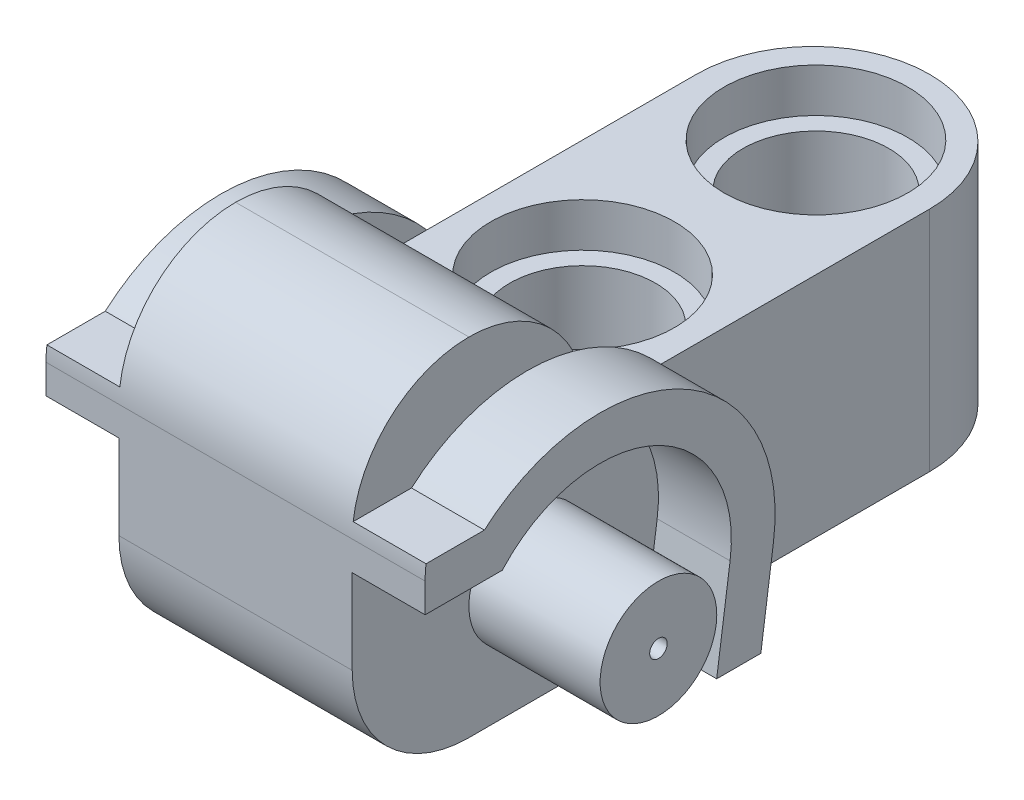
from build123d import *

# Parameters (mm, degrees)
SKETCH_2_W               = 23.8
SKETCH_2_H               = 16
EXTRUDE_1_DEPTH          = 4
EXTRUDE_START            = 4
EXTRUDE_3_DEPTH          = 4.5
SKETCH_5_R               = 0.3
CUT_EXTRUDE_10_DEPTH     = 1
CUT_EXTRUDE_5_DEPTH      = 22.285910833
EXTRUDE_2_DEPTH          = 2.5
CUT_EXTRUDE_6_DEPTH      = 24.036926878
CUT_EXTRUDE_6_DEPTH_BACK = 24.036926878
CUT_EXTRUDE_7_DEPTH      = 1.5
CUT_EXTRUDE_START        = -6.3
CUT_EXTRUDE_8_DEPTH      = 1.5
CUT_EXTRUDE_9_DEPTH      = 22.285910833
CUT_EXTRUDE_9_DEPTH_BACK = 22.285910833
SKETCH_4_W               = 11.51085618
SKETCH_4_H               = 4.1
FILLET_1_R               = 4


with BuildPart() as part:
    # 草图2 → 凸台-拉伸1 (new body)
    with BuildSketch(Plane(origin=(0, 0, 0), x_dir=(0, 0, -1), z_dir=(1, 0, 0))):
        with Locations((5.9, 0)):
            Rectangle(SKETCH_2_W, SKETCH_2_H)
    extrude(amount=EXTRUDE_1_DEPTH)

    # 草图2<10> → 凸台-拉伸3 (add)
    with BuildSketch(Plane(origin=(0, 0, 0), x_dir=(0, 0, -1), z_dir=(1, 0, 0)).offset(EXTRUDE_START)):
        with BuildLine():
            ThreePointArc((0, -2), (1.414213562, -1.414213562), (2, 0))
            Line((2, 0), (0, 0))
            Line((0, 0), (0, -2))
        make_face()
        with BuildLine():
            Line((0, 0), (2, 0))
            ThreePointArc((2, 0), (1.414213562, 1.414213562), (0, 2))
            Line((0, 2), (0, 0))
        make_face()
        with BuildLine():
            Line((0, -2), (0, 0))
            Line((0, 0), (-2, 0))
            ThreePointArc((-2, 0), (-1.414213562, -1.414213562), (0, -2))
        make_face()
        with BuildLine():
            Line((-2, 0), (0, 0))
            Line((0, 0), (0, 2))
            ThreePointArc((0, 2), (-1.414213562, 1.414213562), (-2, 0))
        make_face()
    extrude(amount=EXTRUDE_3_DEPTH)

    # 草图5 → 切除-拉伸10 (cut)
    with BuildSketch(Plane(origin=(8.5, 0, 0), x_dir=(0, 0, -1), z_dir=(1, 0, 0))):
        Circle(SKETCH_5_R)
    extrude(amount=-CUT_EXTRUDE_10_DEPTH, mode=Mode.SUBTRACT)

    # 草图2<9> → 切除-拉伸5 (cut, through all)
    with BuildSketch(Plane(origin=(0, 0, 0), x_dir=(0, 0, -1), z_dir=(1, 0, 0))):
        with BuildLine():
            ThreePointArc((2.244994432, 3.9), (2.123509625, 3.96745597), (2, 4.031128874))
            Line((2, 4.031128874), (2, 3.9))
            Line((2, 3.9), (2.244994432, 3.9))
        make_face()
        with BuildLine():
            ThreePointArc((4.559605246, 3.9), (3.39539975, 4.946843493), (2, 5.656854249))
            Line((2, 5.656854249), (2, 4.031128874))
            ThreePointArc((2, 4.031128874), (2.123509625, 3.96745597), (2.244994432, 3.9))
            Line((2.244994432, 3.9), (4.559605246, 3.9))
        make_face()
        with BuildLine():
            Line((17.8, 8), (2, 8))
            Line((2, 8), (2, 5.656854249))
            ThreePointArc((2, 5.656854249), (3.39539975, 4.946843493), (4.559605246, 3.9))
            Line((4.559605246, 3.9), (17.8, 3.9))
            Line((17.8, 3.9), (17.8, 8))
        make_face()
        with BuildLine():
            Line((2, -4.031128874), (2, -5.656854249))
            ThreePointArc((2, -5.656854249), (3.002792751, -5.194539026), (3.903880188, -4.556283516))
            Line((3.903880188, -4.556283516), (3.996114821, -3.9))
            Line((3.996114821, -3.9), (2.244994432, -3.9))
            ThreePointArc((2.244994432, -3.9), (2.123509625, -3.96745597), (2, -4.031128874))
        make_face()
        with BuildLine():
            ThreePointArc((3.903880188, -4.556283516), (3.002792751, -5.194539026), (2, -5.656854249))
            Line((2, -5.656854249), (2, -8))
            Line((2, -8), (3.419897399, -8))
            Line((3.419897399, -8), (3.903880188, -4.556283516))
        make_face()
        with BuildLine():
            ThreePointArc((3.903880188, -4.556283516), (4.244446187, -4.240834418), (4.559605246, -3.9))
            Line((4.559605246, -3.9), (3.996114821, -3.9))
            Line((3.996114821, -3.9), (3.903880188, -4.556283516))
        make_face()
        with BuildLine():
            Line((4.934638757, -8), (5.51085618, -3.9))
            Line((5.51085618, -3.9), (4.559605246, -3.9))
            ThreePointArc((4.559605246, -3.9), (4.244446187, -4.240834418), (3.903880188, -4.556283516))
            Line((3.903880188, -4.556283516), (3.419897399, -8))
            Line((3.419897399, -8), (4.934638757, -8))
        make_face()
        Polygon((17.8, -8), (17.8, -3.9), (5.51085618, -3.9), (4.934638757, -8), align=None)
    extrude(amount=CUT_EXTRUDE_5_DEPTH, mode=Mode.SUBTRACT)

    # 草图2<4> → 凸台-拉伸2 (add)
    with BuildSketch(Plane(origin=(0, 0, 0), x_dir=(0, 0, -1), z_dir=(1, 0, 0)).offset(EXTRUDE_START)):
        with BuildLine():
            Line((4.934638757, -8), (5.51085618, -3.9))
            Line((5.51085618, -3.9), (4.559605246, -3.9))
            ThreePointArc((4.559605246, -3.9), (4.244446187, -4.240834418), (3.903880188, -4.556283516))
            Line((3.903880188, -4.556283516), (3.419897399, -8))
            Line((3.419897399, -8), (4.934638757, -8))
        make_face()
        with BuildLine():
            Line((4.559605246, -3.9), (3.996114821, -3.9))
            Line((3.996114821, -3.9), (3.903880188, -4.556283516))
            ThreePointArc((3.903880188, -4.556283516), (4.244446187, -4.240834418), (4.559605246, -3.9))
        make_face()
        with BuildLine():
            Line((6, 0), (4.5, 0))
            ThreePointArc((4.5, 0), (4.489038226, -0.313904132), (4.456206309, -0.626278954))
            Line((4.456206309, -0.626278954), (3.996114821, -3.9))
            Line((3.996114821, -3.9), (4.559605246, -3.9))
            ThreePointArc((4.559605246, -3.9), (5.469677245, -2.466299016), (5.941608412, -0.835038606))
            ThreePointArc((5.941608412, -0.835038606), (5.985384302, -0.418538842), (6, 0))
        make_face()
        with BuildLine():
            Line((5.51085618, -3.9), (5.941608412, -0.835038606))
            ThreePointArc((5.941608412, -0.835038606), (5.469677245, -2.466299016), (4.559605246, -3.9))
            Line((4.559605246, -3.9), (5.51085618, -3.9))
        make_face()
        with BuildLine():
            ThreePointArc((2.244994432, 3.9), (3.895669066, 2.252501394), (4.5, 0))
            Line((4.5, 0), (6, 0))
            ThreePointArc((6, 0), (5.628393709, 2.078745839), (4.559605246, 3.9))
            Line((4.559605246, 3.9), (2.244994432, 3.9))
        make_face()
        with BuildLine():
            ThreePointArc((2, 4.031128874), (2.123509625, 3.96745597), (2.244994432, 3.9))
            Line((2.244994432, 3.9), (4.559605246, 3.9))
            ThreePointArc((4.559605246, 3.9), (3.39539975, 4.946843493), (2, 5.656854249))
            Line((2, 5.656854249), (2, 4.031128874))
        make_face()
        with BuildLine():
            ThreePointArc((0, 4.5), (1.027112473, 4.38121444), (2, 4.031128874))
            Line((2, 4.031128874), (2, 5.656854249))
            ThreePointArc((2, 5.656854249), (-1.141687773, 5.890377664), (-3.968626967, 4.5))
            Line((-3.968626967, 4.5), (0, 4.5))
        make_face()
        with BuildLine():
            ThreePointArc((-3.354101966, 3), (-1.837117307, 4.107919181), (0, 4.5))
            Line((0, 4.5), (-3.968626967, 4.5))
            ThreePointArc((-3.968626967, 4.5), (-4.643360347, 3.799895352), (-5.196152423, 3))
            Line((-5.196152423, 3), (-3.354101966, 3))
        make_face()
        with BuildLine():
            ThreePointArc((-5.196152423, 3), (-4.643360347, 3.799895352), (-3.968626967, 4.5))
            Line((-3.968626967, 4.5), (-6, 4.5))
            Line((-6, 4.5), (-6, 3))
            Line((-6, 3), (-5.196152423, 3))
        make_face()
    extrude(amount=EXTRUDE_2_DEPTH)

    # 镜向1: part across plane


with BuildPart() as part_1:
    add(part.part)
    add(part.part.mirror(Plane(origin=(0, 0, 0), x_dir=(0, 0, 1), z_dir=(1, 0, 0))))

    # 草图3 → 切除-拉伸6 (cut, two sides: drawn at the far end of the back side and taken through both)
    with BuildSketch(Plane(origin=(0, 3.9, 0), x_dir=(1, 0, 0), z_dir=(0, 1, 0)).offset(-CUT_EXTRUDE_6_DEPTH_BACK)):
        with BuildLine():
            ThreePointArc((2.5, 13.9), (1.767766953, 15.667766953), (0, 16.4))
            Line((0, 16.4), (0, 11.4))
            ThreePointArc((0, 11.4), (1.767766953, 12.132233047), (2.5, 13.9))
        make_face()
        with BuildLine():
            Line((0, 11.4), (0, 16.4))
            ThreePointArc((0, 16.4), (-2.5, 13.9), (0, 11.4))
        make_face()
        with BuildLine():
            ThreePointArc((2.5, 5.9), (1.767766953, 7.667766953), (0, 8.4))
            Line((0, 8.4), (0, 3.4))
            ThreePointArc((0, 3.4), (1.767766953, 4.132233047), (2.5, 5.9))
        make_face()
        with BuildLine():
            Line((0, 3.4), (0, 8.4))
            ThreePointArc((0, 8.4), (-2.5, 5.9), (0, 3.4))
        make_face()
    extrude(amount=CUT_EXTRUDE_6_DEPTH + CUT_EXTRUDE_6_DEPTH_BACK, mode=Mode.SUBTRACT)

    # 草图3<4> → 切除-拉伸7 (cut)
    with BuildSketch(Plane(origin=(0, 3.9, 0), x_dir=(1, 0, 0), z_dir=(0, 1, 0))):
        with BuildLine():
            ThreePointArc((3.15, 5.9), (2.227386361, 8.127386361), (0, 9.05))
            Line((0, 9.05), (0, 8.4))
            ThreePointArc((0, 8.4), (1.767766953, 7.667766953), (2.5, 5.9))
            ThreePointArc((2.5, 5.9), (1.767766953, 4.132233047), (0, 3.4))
            Line((0, 3.4), (0, 2.75))
            ThreePointArc((0, 2.75), (2.227386361, 3.672613639), (3.15, 5.9))
        make_face()
        with BuildLine():
            Line((0, 8.4), (0, 9.05))
            ThreePointArc((0, 9.05), (-3.15, 5.9), (0, 2.75))
            Line((0, 2.75), (0, 3.4))
            ThreePointArc((0, 3.4), (-2.5, 5.9), (0, 8.4))
        make_face()
        with BuildLine():
            ThreePointArc((3.15, 13.9), (2.227386361, 16.127386361), (0, 17.05))
            Line((0, 17.05), (0, 16.4))
            ThreePointArc((0, 16.4), (1.767766953, 15.667766953), (2.5, 13.9))
            ThreePointArc((2.5, 13.9), (1.767766953, 12.132233047), (0, 11.4))
            Line((0, 11.4), (0, 10.75))
            ThreePointArc((0, 10.75), (2.227386361, 11.672613639), (3.15, 13.9))
        make_face()
        with BuildLine():
            Line((0, 16.4), (0, 17.05))
            ThreePointArc((0, 17.05), (-3.15, 13.9), (0, 10.75))
            Line((0, 10.75), (0, 11.4))
            ThreePointArc((0, 11.4), (-2.5, 13.9), (0, 16.4))
        make_face()
    extrude(amount=-CUT_EXTRUDE_7_DEPTH, mode=Mode.SUBTRACT)

    # 草图3<5> → 切除-拉伸8 (cut)
    with BuildSketch(Plane(origin=(0, 3.9, 0), x_dir=(1, 0, 0), z_dir=(0, 1, 0)).offset(CUT_EXTRUDE_START)):
        with BuildLine():
            ThreePointArc((3.15, 5.9), (2.227386361, 8.127386361), (0, 9.05))
            Line((0, 9.05), (0, 8.4))
            ThreePointArc((0, 8.4), (1.767766953, 7.667766953), (2.5, 5.9))
            ThreePointArc((2.5, 5.9), (1.767766953, 4.132233047), (0, 3.4))
            Line((0, 3.4), (0, 2.75))
            ThreePointArc((0, 2.75), (2.227386361, 3.672613639), (3.15, 5.9))
        make_face()
        with BuildLine():
            Line((0, 8.4), (0, 9.05))
            ThreePointArc((0, 9.05), (-3.15, 5.9), (0, 2.75))
            Line((0, 2.75), (0, 3.4))
            ThreePointArc((0, 3.4), (-2.5, 5.9), (0, 8.4))
        make_face()
        with BuildLine():
            ThreePointArc((3.15, 13.9), (2.227386361, 16.127386361), (0, 17.05))
            Line((0, 17.05), (0, 16.4))
            ThreePointArc((0, 16.4), (1.767766953, 15.667766953), (2.5, 13.9))
            ThreePointArc((2.5, 13.9), (1.767766953, 12.132233047), (0, 11.4))
            Line((0, 11.4), (0, 10.75))
            ThreePointArc((0, 10.75), (2.227386361, 11.672613639), (3.15, 13.9))
        make_face()
        with BuildLine():
            Line((0, 16.4), (0, 17.05))
            ThreePointArc((0, 17.05), (-3.15, 13.9), (0, 10.75))
            Line((0, 10.75), (0, 11.4))
            ThreePointArc((0, 11.4), (-2.5, 13.9), (0, 16.4))
        make_face()
    extrude(amount=-CUT_EXTRUDE_8_DEPTH, mode=Mode.SUBTRACT)

    # 草图4 → 切除-拉伸9 (cut, two sides: drawn at the far end of the back side and taken through both)
    with BuildSketch(Plane(origin=(0, 0, 0), x_dir=(0, 0, -1), z_dir=(1, 0, 0)).offset(-CUT_EXTRUDE_9_DEPTH_BACK)):
        with Locations((-0.24457191, -5.95)):
            Rectangle(SKETCH_4_W, SKETCH_4_H)
    extrude(amount=CUT_EXTRUDE_9_DEPTH + CUT_EXTRUDE_9_DEPTH_BACK, mode=Mode.SUBTRACT)

    # 圆角1
    # the kernel refuses this fillet: 4 mm, written as the material it takes off along each edge
    with BuildSketch(Plane(origin=(-4, 13.9, -17.8), x_dir=(1, 0, 0), z_dir=(0, -1, 0))) as fillet_1_piece_1:
        with BuildLine():
            CenterArc((FILLET_1_R, FILLET_1_R), FILLET_1_R, 180, 90)
            Line((0, FILLET_1_R), (0, 0))
            Line((0, 0), (FILLET_1_R, 0))
        make_face()
    extrude(amount=27.8, mode=Mode.SUBTRACT)
    with BuildSketch(Plane(origin=(14, -3.9, 6), x_dir=(0, 0, -1), z_dir=(-1, 0, 0)), Plane(origin=(-14, 8, 6), x_dir=(0, 0, -1), z_dir=(1, 0, 0))) as fillet_1_piece_2:
        with BuildLine():
            CenterArc((FILLET_1_R, -FILLET_1_R), FILLET_1_R, 90, 90)
            Line((0, -FILLET_1_R), (0, 0))
            Line((0, 0), (FILLET_1_R, 0))
        make_face()
    extrude(amount=28, mode=Mode.SUBTRACT)
    with BuildSketch(Plane(origin=(4, 13.9, -17.8), x_dir=(-1, 0, 0), z_dir=(0, -1, 0))) as fillet_1_piece_3:
        with BuildLine():
            CenterArc((FILLET_1_R, -FILLET_1_R), FILLET_1_R, 90, 90)
            Line((0, -FILLET_1_R), (0, 0))
            Line((0, 0), (FILLET_1_R, 0))
        make_face()
    extrude(amount=27.8, mode=Mode.SUBTRACT)
    with BuildSketch(Plane(origin=(4, 8, -2), x_dir=(0, 0, 1), z_dir=(-1, 0, 0))) as fillet_1_piece_4:
        with BuildLine():
            CenterArc((FILLET_1_R, -FILLET_1_R), FILLET_1_R, 90, 90)
            Line((0, -FILLET_1_R), (0, 0))
            Line((0, 0), (FILLET_1_R, 0))
        make_face()
    extrude(amount=8, mode=Mode.SUBTRACT)


solid = part_1.part
